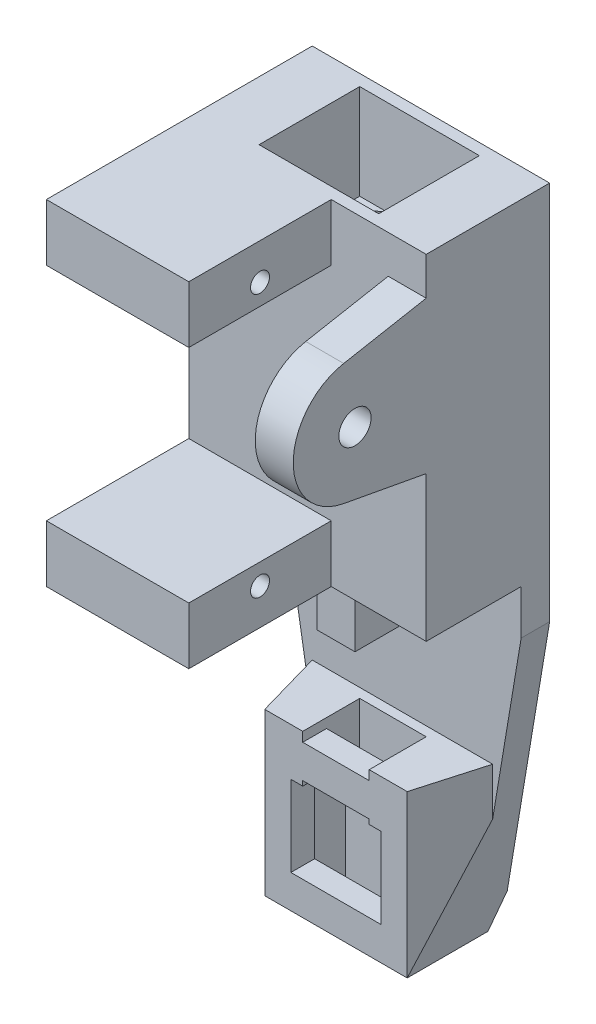
from build123d import *
from OCP.BRepFilletAPI import BRepFilletAPI_MakeChamfer

# Parameters (mm, degrees)
RESSALTO_EXTRUS_O1_DEPTH = 13
ESBO_O2_W                = 15
ESBO_O2_H                = 6
ESBO_O2_W_2              = 4
ESBO_O2_H_2              = 16
RESSALTO_EXTRUS_O2_DEPTH = 15
ESBO_O3_R                = 1
CORTE_EXTRUS_O1_DEPTH    = 77.870020164
ESBO_O10_R               = 1.7
CORTE_EXTRUS_O4_DEPTH    = 10
ESBO_O11_W               = 25
ESBO_O11_H               = 34.7
CORTE_EXTRUS_O5_DEPTH    = 10
RESSALTO_EXTRUS_O3_DEPTH = 17
RESSALTO_EXTRUS_O4_REACH = 77.374
ESBO_O7_W                = 4
ESBO_O7_H                = 5
ESBO_O8_W                = 15
ESBO_O8_H                = 3.5
RESSALTO_EXTRUS_O5_DEPTH = 2.5
CHANFRO2_SIZE            = 2
CHANFRO2_SIZE_2          = 7
CHANFRO3_SIZE            = 1.5
CHANFRO3_SIZE2           = 3.216760381
ESBO_O12_W               = 12.6
ESBO_O12_H               = 10.6
CORTE_EXTRUS_O6_DEPTH    = 10
CORTE_EXTRUS_O7_DEPTH    = 22
ESBO_O15_R               = 2
CORTE_EXTRUS_O9_DEPTH    = 15


with BuildPart() as part:
    # Esboço1 → Ressalto-extrusão1 (new body)
    with BuildSketch(Plane.XY):
        Polygon((-12.5, 0), (12.5, 0), (12.5, -40), (7.5, -70), (-7.5, -70), (-12.5, -40), align=None)
    extrude(amount=RESSALTO_EXTRUS_O1_DEPTH)

    # Esboço2 → Ressalto-extrusão2 (add)
    with BuildSketch(Plane.XY.offset(13)):
        with Locations((-5, -32.3)):
            Rectangle(ESBO_O2_W, ESBO_O2_H)
        with Locations((-5, -3)):
            Rectangle(ESBO_O2_W, ESBO_O2_H)
        with Locations((10.5, -12)):
            Rectangle(ESBO_O2_W_2, ESBO_O2_H_2)
    extrude(amount=RESSALTO_EXTRUS_O2_DEPTH)

    # Esboço3 → Corte-extrusão1 (cut, through all)
    with BuildSketch(Plane(origin=(2.5, 0, 0), x_dir=(0, 0, -1), z_dir=(1, 0, 0))):
        with Locations(Location((-20.5, -3.8, 0), (0, 0, 90))):
            Circle(ESBO_O3_R)
        with Locations(Location((-20.5, -31.5, 0), (0, 0, 270))):
            Circle(ESBO_O3_R)
    extrude(amount=-CORTE_EXTRUS_O1_DEPTH, mode=Mode.SUBTRACT)

    # Esboço10 → Corte-extrusão4 (cut)
    with BuildSketch(Plane(origin=(12.5, 0, 0), x_dir=(0, 0, -1), z_dir=(1, 0, 0))):
        with Locations((-20.5, -12)):
            Circle(ESBO_O10_R)
        with BuildLine():
            Line((-13, -4), (-28, -4))
            Line((-28, -4), (-28, -20))
            Line((-28, -20), (-13, -20))
            Line((-13, -20), (-21.684004699, -18.391254405))
            ThreePointArc((-21.684004699, -18.391254405), (-27, -12), (-21.684004699, -5.608745595))
            Line((-21.684004699, -5.608745595), (-13, -4))
        make_face()
    extrude(amount=-CORTE_EXTRUS_O4_DEPTH, mode=Mode.SUBTRACT)

    # Esboço11 → Corte-extrusão5 (cut)
    with BuildSketch(Plane.XY.offset(13)):
        with Locations((0, -52.65)):
            Rectangle(ESBO_O11_W, ESBO_O11_H)
    extrude(amount=-CORTE_EXTRUS_O5_DEPTH, mode=Mode.SUBTRACT)

    # Esboço6 → Ressalto-extrusão3 (add)
    with BuildSketch(Plane.XZ.offset(70)):
        Polygon((-5, 4), (-5, 7.5), (-4.75, 7.5), (-4.75, 10), (-7.5, 10), (-7.5, 3), (7.5, 3), (7.5, 10), (4.75, 10), (4.75, 7.5), (5, 7.5), (5, 4), align=None)
    extrude(amount=-RESSALTO_EXTRUS_O3_DEPTH)

    # Ressalto-extrusão4: up to this face of the body (flat: up to its plane)
    ressalto_extrus_o4_end = Plane(part.part.faces().sort_by_distance((-6.125, -61.5, 10))[0])
    # Esboço7 → Ressalto-extrusão4 (add, up to the picked face)
    with BuildSketch(Plane.XY.offset(3), mode=Mode.PRIVATE) as ressalto_extrus_o4_sk1:
        with Locations((0, -40.5)):
            Rectangle(ESBO_O7_W, ESBO_O7_H)
    ressalto_extrus_o4_tool1 = split(extrude(ressalto_extrus_o4_sk1.sketch, amount=RESSALTO_EXTRUS_O4_REACH, mode=Mode.PRIVATE), bisect_by=ressalto_extrus_o4_end, keep=Keep.BOTH, mode=Mode.PRIVATE)
    # Esboço7 → Ressalto-extrusão4 (add, up to the picked face)
    with BuildSketch(Plane.XY.offset(3), mode=Mode.PRIVATE) as ressalto_extrus_o4_sk2:
        with Locations((5.5, -55.5)):
            Rectangle(ESBO_O7_W, ESBO_O7_H)
    ressalto_extrus_o4_tool2 = split(extrude(ressalto_extrus_o4_sk2.sketch, amount=RESSALTO_EXTRUS_O4_REACH, mode=Mode.PRIVATE), bisect_by=ressalto_extrus_o4_end, keep=Keep.BOTH, mode=Mode.PRIVATE)
    # Esboço7 → Ressalto-extrusão4 (add, up to the picked face)
    with BuildSketch(Plane.XY.offset(3), mode=Mode.PRIVATE) as ressalto_extrus_o4_sk3:
        with Locations((-5.5, -55.5)):
            Rectangle(ESBO_O7_W, ESBO_O7_H)
    ressalto_extrus_o4_tool3 = split(extrude(ressalto_extrus_o4_sk3.sketch, amount=RESSALTO_EXTRUS_O4_REACH, mode=Mode.PRIVATE), bisect_by=ressalto_extrus_o4_end, keep=Keep.BOTH, mode=Mode.PRIVATE)
    add(ressalto_extrus_o4_tool1.solids().sort_by(Axis((0, -40.5, 3), (0, 0, 1)))[0])
    add(ressalto_extrus_o4_tool2.solids().sort_by(Axis((5.5, -55.5, 3), (0, 0, 1)))[0])
    add(ressalto_extrus_o4_tool3.solids().sort_by(Axis((-5.5, -55.5, 3), (0, 0, 1)))[0])

    # Esboço8 → Ressalto-extrusão5 (add)
    with BuildSketch(Plane.XY.offset(10)):
        with Locations((0, -68.25)):
            Rectangle(ESBO_O8_W, ESBO_O8_H)
        with Locations((0, -55.75)):
            Rectangle(ESBO_O8_W, ESBO_O8_H)
    extrude(amount=-RESSALTO_EXTRUS_O5_DEPTH)

    # Chanfro2
    chanfro2_edges_1 = [part.edges().sort_by_distance(p)[0] for p in [
        (7.5, -61.5, 3),
    ]]
    chanfro2_side_1 = [part.faces().sort_by_distance(p)[0] for p in [
        (7.54, -61.5, 3),
    ]]
    chanfro2_edges_2 = [part.edges().sort_by_distance(p)[0] for p in [
        (-7.5, -61.5, 3),
    ]]
    chanfro2_side_2 = [part.faces().sort_by_distance(p)[0] for p in [
        (-7.54, -61.5, 3),
    ]]
    chanfro2 = BRepFilletAPI_MakeChamfer(part.part.solid().wrapped)
    for e in chanfro2_edges_1:
        chanfro2.Add(CHANFRO2_SIZE - 0.0001, CHANFRO2_SIZE_2 - 0.0001, e.wrapped, chanfro2_side_1[0].wrapped)
    for e in chanfro2_edges_2:
        chanfro2.Add(CHANFRO2_SIZE - 0.0001, CHANFRO2_SIZE_2 - 0.0001, e.wrapped, chanfro2_side_2[0].wrapped)
    add(Compound.cast(chanfro2.Shape()), mode=Mode.REPLACE)  # a hair under: the kernel refuses the full size

    # Chanfro3
    chanfro3_edges = [part.edges().sort_by_distance(p)[0] for p in [
        (0, -70, 0),
    ]]
    chanfro3_side = [part.faces().sort_by_distance(p)[0] for p in [
        (7.319722436, -70, 9.99995),
    ]]
    chamfer(chanfro3_edges, length=CHANFRO3_SIZE, length2=CHANFRO3_SIZE2, reference=chanfro3_side[0])

    # Esboço12 → Corte-extrusão6 (cut)
    with BuildSketch(Plane(origin=(0, 0, 0), x_dir=(1, 0, 0), z_dir=(0, 1, 0))):
        with Locations((0, -6.5)):
            Rectangle(ESBO_O12_W, ESBO_O12_H)
    extrude(amount=-CORTE_EXTRUS_O6_DEPTH, mode=Mode.SUBTRACT)

    # Esboço13 → Corte-extrusão7 (cut)
    with BuildSketch(Plane(origin=(0, -10, 0), x_dir=(1, 0, 0), z_dir=(0, 1, 0))):
        with BuildLine():
            Line((-3.405877273, -11.8), (3.405877273, -11.8))
            ThreePointArc((3.405877273, -11.8), (6.3, -6.5), (3.405877273, -1.2))
            Line((3.405877273, -1.2), (-3.405877273, -1.2))
            ThreePointArc((-3.405877273, -1.2), (-6.3, -6.5), (-3.405877273, -11.8))
        make_face()
    extrude(amount=-CORTE_EXTRUS_O7_DEPTH, mode=Mode.SUBTRACT)

    # Esboço15 → Corte-extrusão9 (cut)
    with BuildSketch(Plane.ZY.offset(12.5)):
        with Locations((6, -28)):
            Circle(ESBO_O15_R)
    extrude(amount=-CORTE_EXTRUS_O9_DEPTH, mode=Mode.SUBTRACT)


solid = part.part
